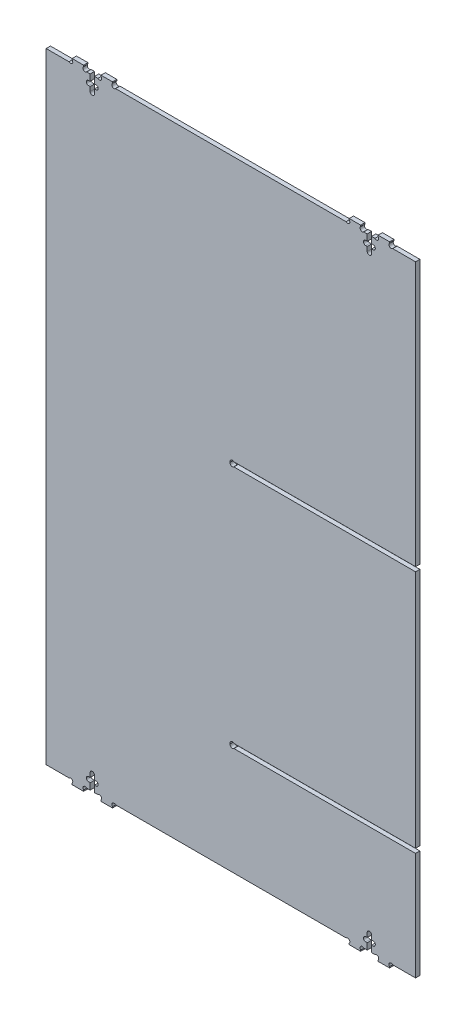
from build123d import *

# Parameters (mm, degrees)
SKETCH_1_W                      = 524
SKETCH_1_H                      = 865.6
EXTRUDE_1_DEPTH                 = 6
SKETCH_5541_W                   = 16
SKETCH_5541_H                   = 6.01
EXTRUDE_6_DEPTH                 = 6
CUT_EXTRUDE_5_DEPTH             = 753.700441094
CUT_EXTRUDE_5_DEPTH_BACK        = 753.700441094
SKETCH_5_W                      = 328
SKETCH_5_H                      = 6
CUT_EXTRUDE_6_01_DEPTH          = 750.906944813
CUT_EXTRUDE_6_01_DEPTH_BACK     = 750.906944813
SKETCH_6_01_W                   = 6
SKETCH_6_01_H                   = 21.2
CUT_EXTRUDE_6_01_2_DEPTH        = 750.906944813
CUT_EXTRUDE_6_01_2_DEPTH_BACK   = 750.906944813
SKETCH_6_01_2_W                 = 10.3
SKETCH_6_01_2_H                 = 6.2
CUT_EXTRUDE_6_01_1_DEPTH        = 750.906944813
CUT_EXTRUDE_6_01_1_DEPTH_BACK   = 750.906944813
SKETCH_6_01_1_R                 = 3.05
CUT_EXTRUDE_6_01_1_2_DEPTH      = 750.906944813
CUT_EXTRUDE_6_01_1_2_DEPTH_BACK = 750.906944813
SKETCH_6_01_1_2_R               = 3.05
CUT_EXTRUDE_6_01_3_DEPTH        = 750.906944813
CUT_EXTRUDE_6_01_3_DEPTH_BACK   = 750.906944813
SKETCH_6_01_3_R                 = 3
CUT_EXTRUDE_6_02_DEPTH          = 750.906944813
CUT_EXTRUDE_6_02_DEPTH_BACK     = 750.906944813
SKETCH_6_02_W                   = 6
SKETCH_6_02_H                   = 21.2
CUT_EXTRUDE_6_02_2_DEPTH        = 750.906944813
CUT_EXTRUDE_6_02_2_DEPTH_BACK   = 750.906944813
SKETCH_6_02_2_W                 = 10.3
SKETCH_6_02_2_H                 = 6.2
CUT_EXTRUDE_6_02_1_DEPTH        = 750.906944813
CUT_EXTRUDE_6_02_1_DEPTH_BACK   = 750.906944813
SKETCH_6_02_1_R                 = 3.05
CUT_EXTRUDE_6_02_1_2_DEPTH      = 750.906944813
CUT_EXTRUDE_6_02_1_2_DEPTH_BACK = 750.906944813
SKETCH_6_02_1_2_R               = 3.05
CUT_EXTRUDE_6_02_3_DEPTH        = 750.906944813
CUT_EXTRUDE_6_02_3_DEPTH_BACK   = 750.906944813
SKETCH_6_02_3_R                 = 3
CUT_EXTRUDE_6_03_DEPTH          = 750.906944813
CUT_EXTRUDE_6_03_DEPTH_BACK     = 750.906944813
SKETCH_6_03_W                   = 6
SKETCH_6_03_H                   = 21.2
CUT_EXTRUDE_6_03_2_DEPTH        = 750.906944813
CUT_EXTRUDE_6_03_2_DEPTH_BACK   = 750.906944813
SKETCH_6_03_2_W                 = 10.3
SKETCH_6_03_2_H                 = 6.2
CUT_EXTRUDE_6_03_1_DEPTH        = 750.906944813
CUT_EXTRUDE_6_03_1_DEPTH_BACK   = 750.906944813
SKETCH_6_03_1_R                 = 3.05
CUT_EXTRUDE_6_03_1_2_DEPTH      = 750.906944813
CUT_EXTRUDE_6_03_1_2_DEPTH_BACK = 750.906944813
SKETCH_6_03_1_2_R               = 3.05
CUT_EXTRUDE_6_03_3_DEPTH        = 750.906944813
CUT_EXTRUDE_6_03_3_DEPTH_BACK   = 750.906944813
SKETCH_6_03_3_R                 = 3
CUT_EXTRUDE_6_04_DEPTH          = 750.906944813
CUT_EXTRUDE_6_04_DEPTH_BACK     = 750.906944813
SKETCH_6_04_W                   = 6
SKETCH_6_04_H                   = 21.2
CUT_EXTRUDE_6_04_2_DEPTH        = 750.906944813
CUT_EXTRUDE_6_04_2_DEPTH_BACK   = 750.906944813
SKETCH_6_04_2_W                 = 10.3
SKETCH_6_04_2_H                 = 6.2
CUT_EXTRUDE_6_04_1_DEPTH        = 750.906944813
CUT_EXTRUDE_6_04_1_DEPTH_BACK   = 750.906944813
SKETCH_6_04_1_R                 = 3.05
CUT_EXTRUDE_6_04_1_2_DEPTH      = 750.906944813
CUT_EXTRUDE_6_04_1_2_DEPTH_BACK = 750.906944813
SKETCH_6_04_1_2_R               = 3.05
CUT_EXTRUDE_6_04_3_DEPTH        = 750.906944813
CUT_EXTRUDE_6_04_3_DEPTH_BACK   = 750.906944813
SKETCH_6_04_3_R                 = 3
CUT_EXTRUDE_01_DEPTH            = 750.906944813
CUT_EXTRUDE_01_DEPTH_BACK       = 750.906944813
SKETCH_01_R                     = 3.05
CUT_EXTRUDE_02_DEPTH            = 750.906944813
CUT_EXTRUDE_02_DEPTH_BACK       = 750.906944813
SKETCH_02_R                     = 3.05
CUT_EXTRUDE_03_DEPTH            = 750.906944813
CUT_EXTRUDE_03_DEPTH_BACK       = 750.906944813
SKETCH_03_R                     = 3.05
CUT_EXTRUDE_04_DEPTH            = 750.906944813
CUT_EXTRUDE_04_DEPTH_BACK       = 750.906944813
SKETCH_04_R                     = 3.05


with BuildPart() as part:
    # Эскиз1 → Бобышка-Вытянуть1 (new body)
    with BuildSketch(Plane.XY):
        with Locations((-90.794024, 232.074672892)):
            Rectangle(SKETCH_1_W, SKETCH_1_H)
    extrude(amount=-EXTRUDE_1_DEPTH)

    # Sketch 5541 → Стыки_добавленные_шипы_6мм (add)
    with BuildSketch(Plane.XY):
        with Locations((-262.794024, -203.720327)):
            Rectangle(SKETCH_5541_W, SKETCH_5541_H)
        with Locations((-302.794024, -203.720327)):
            Rectangle(SKETCH_5541_W, SKETCH_5541_H)
        with Locations((121.205976, -203.720327)):
            Rectangle(SKETCH_5541_W, SKETCH_5541_H)
        with Locations((81.205976, -203.720327)):
            Rectangle(SKETCH_5541_W, SKETCH_5541_H)
    extrude(amount=-EXTRUDE_6_DEPTH)

    # Стыки_эскиз_пазов_и_стяжек_М5 → Стыки_шип_паз_стяжки_М5 (cut, two sides: drawn at the far end of the back side and taken through both)
    with BuildSketch(Plane.XY.offset(-CUT_EXTRUDE_5_DEPTH_BACK)):
        Polygon((-280.044024, -190.875327), (-278.644024, -190.875327), (-278.644024, -186.575327), (-280.044024, -186.575327), (-280.044024, -179.725327), (-285.544024, -179.725327), (-285.544024, -186.575327), (-286.944024, -186.575327), (-286.944024, -190.875327), (-285.544024, -190.875327), (-285.544024, -206.825327), (-280.044024, -206.825327), align=None)
        Polygon((-352.894024, 664.874673), (-352.894024, 658.874673), (-352.794024, 658.874673), (-352.794024, -200.725327), (-346.794024, -200.725327), (-346.794024, 658.874673), (-310.794024, 658.874673), (-310.794024, 664.874673), align=None)
        Polygon((-90.869024, -51.200327), (165.205976, -51.200327), (165.205976, -200.725327), (171.205976, -200.725327), (171.205976, -51.200327), (171.305976, -51.200327), (171.305976, -45.050327), (171.205976, -45.050327), (171.205976, 286.799673), (171.305976, 286.799673), (171.305976, 292.949673), (171.205976, 292.949673), (171.205976, 658.874673), (171.305976, 658.874673), (171.305976, 664.874673), (129.205976, 664.874673), (129.205976, 658.874673), (165.205976, 658.874673), (165.205976, 292.949673), (-90.869024, 292.949673), (-90.869024, 286.799673), (165.205976, 286.799673), (165.205976, -45.050327), (-90.869024, -45.050327), align=None)
        Polygon((98.455976, 658.874673), (98.455976, 649.024673), (97.055976, 649.024673), (97.055976, 644.724673), (98.455976, 644.724673), (98.455976, 637.874673), (103.955976, 637.874673), (103.955976, 644.724673), (105.355976, 644.724673), (105.355976, 649.024673), (103.955976, 649.024673), (103.955976, 658.874673), (113.205976, 658.874673), (113.205976, 664.874673), (103.955976, 664.874673), (103.955976, 664.974673), (98.455976, 664.974673), (98.455976, 664.874673), (89.205976, 664.874673), (89.205976, 658.874673), align=None)
        Polygon((-285.544024, 658.874673), (-285.544024, 649.024673), (-286.944024, 649.024673), (-286.944024, 644.724673), (-285.544024, 644.724673), (-285.544024, 637.874673), (-280.044024, 637.874673), (-280.044024, 644.724673), (-278.644024, 644.724673), (-278.644024, 649.024673), (-280.044024, 649.024673), (-280.044024, 658.874673), (-270.794024, 658.874673), (-270.794024, 664.874673), (-280.044024, 664.874673), (-280.044024, 664.974673), (-285.544024, 664.974673), (-285.544024, 664.874673), (-294.794024, 664.874673), (-294.794024, 658.874673), align=None)
        Polygon((103.955976, -206.825327), (103.955976, -190.875327), (105.355976, -190.875327), (105.355976, -186.575327), (103.955976, -186.575327), (103.955976, -179.725327), (98.455976, -179.725327), (98.455976, -186.575327), (97.055976, -186.575327), (97.055976, -190.875327), (98.455976, -190.875327), (98.455976, -206.825327), align=None)
        with Locations((-90.794024, 661.874673)):
            Rectangle(SKETCH_5_W, SKETCH_5_H)
    extrude(amount=CUT_EXTRUDE_5_DEPTH + CUT_EXTRUDE_5_DEPTH_BACK, mode=Mode.SUBTRACT)

    # Sketch 6_01 → Cut-Extrude 6_01 (cut, two sides: drawn at the far end of the back side and taken through both)
    with BuildSketch(Plane.XY.offset(-CUT_EXTRUDE_6_01_DEPTH_BACK)):
        with Locations((-282.79402, 648.37467)):
            Rectangle(SKETCH_6_01_W, SKETCH_6_01_H)
    extrude(amount=CUT_EXTRUDE_6_01_DEPTH + CUT_EXTRUDE_6_01_DEPTH_BACK, mode=Mode.SUBTRACT)

    # Sketch 6_01 2 → Cut-Extrude 6_01 2 (cut, two sides: drawn at the far end of the back side and taken through both)
    with BuildSketch(Plane.XY.offset(-CUT_EXTRUDE_6_01_2_DEPTH_BACK)):
        with Locations((-282.79402, 646.87467)):
            Rectangle(SKETCH_6_01_2_W, SKETCH_6_01_2_H)
    extrude(amount=CUT_EXTRUDE_6_01_2_DEPTH + CUT_EXTRUDE_6_01_2_DEPTH_BACK, mode=Mode.SUBTRACT)

    # Sketch 6_01_____1 → Cut-Extrude 6_01_____1 (cut, two sides: drawn at the far end of the back side and taken through both)
    with BuildSketch(Plane.XY.offset(-CUT_EXTRUDE_6_01_1_DEPTH_BACK)):
        with Locations((-277.64402, 646.92467)):
            Circle(SKETCH_6_01_1_R)
        with Locations((-287.94402, 646.92467)):
            Circle(SKETCH_6_01_1_R)
    extrude(amount=CUT_EXTRUDE_6_01_1_DEPTH + CUT_EXTRUDE_6_01_1_DEPTH_BACK, mode=Mode.SUBTRACT)

    # Sketch 6_01_____-1 2 → Cut-Extrude 6_01_____-1 2 (cut, two sides: drawn at the far end of the back side and taken through both)
    with BuildSketch(Plane.XY.offset(-CUT_EXTRUDE_6_01_1_2_DEPTH_BACK)):
        with Locations((-277.64402, 646.82467)):
            Circle(SKETCH_6_01_1_2_R)
        with Locations((-287.94402, 646.82467)):
            Circle(SKETCH_6_01_1_2_R)
    extrude(amount=CUT_EXTRUDE_6_01_1_2_DEPTH + CUT_EXTRUDE_6_01_1_2_DEPTH_BACK, mode=Mode.SUBTRACT)

    # Sketch 6_01 3 → Cut-Extrude 6_01 3 (cut, two sides: drawn at the far end of the back side and taken through both)
    with BuildSketch(Plane.XY.offset(-CUT_EXTRUDE_6_01_3_DEPTH_BACK)):
        with Locations((-282.79402, 637.77467)):
            Circle(SKETCH_6_01_3_R)
    extrude(amount=CUT_EXTRUDE_6_01_3_DEPTH + CUT_EXTRUDE_6_01_3_DEPTH_BACK, mode=Mode.SUBTRACT)

    # Sketch 6_02 → Cut-Extrude 6_02 (cut, two sides: drawn at the far end of the back side and taken through both)
    with BuildSketch(Plane.XY.offset(-CUT_EXTRUDE_6_02_DEPTH_BACK)):
        with Locations((101.20598, 648.37467)):
            Rectangle(SKETCH_6_02_W, SKETCH_6_02_H)
    extrude(amount=CUT_EXTRUDE_6_02_DEPTH + CUT_EXTRUDE_6_02_DEPTH_BACK, mode=Mode.SUBTRACT)

    # Sketch 6_02 2 → Cut-Extrude 6_02 2 (cut, two sides: drawn at the far end of the back side and taken through both)
    with BuildSketch(Plane.XY.offset(-CUT_EXTRUDE_6_02_2_DEPTH_BACK)):
        with Locations((101.20598, 646.87467)):
            Rectangle(SKETCH_6_02_2_W, SKETCH_6_02_2_H)
    extrude(amount=CUT_EXTRUDE_6_02_2_DEPTH + CUT_EXTRUDE_6_02_2_DEPTH_BACK, mode=Mode.SUBTRACT)

    # Sketch 6_02_____1 → Cut-Extrude 6_02_____1 (cut, two sides: drawn at the far end of the back side and taken through both)
    with BuildSketch(Plane.XY.offset(-CUT_EXTRUDE_6_02_1_DEPTH_BACK)):
        with Locations((106.35598, 646.92467)):
            Circle(SKETCH_6_02_1_R)
        with Locations((96.05598, 646.92467)):
            Circle(SKETCH_6_02_1_R)
    extrude(amount=CUT_EXTRUDE_6_02_1_DEPTH + CUT_EXTRUDE_6_02_1_DEPTH_BACK, mode=Mode.SUBTRACT)

    # Sketch 6_02_____-1 2 → Cut-Extrude 6_02_____-1 2 (cut, two sides: drawn at the far end of the back side and taken through both)
    with BuildSketch(Plane.XY.offset(-CUT_EXTRUDE_6_02_1_2_DEPTH_BACK)):
        with Locations((106.35598, 646.82467)):
            Circle(SKETCH_6_02_1_2_R)
        with Locations((96.05598, 646.82467)):
            Circle(SKETCH_6_02_1_2_R)
    extrude(amount=CUT_EXTRUDE_6_02_1_2_DEPTH + CUT_EXTRUDE_6_02_1_2_DEPTH_BACK, mode=Mode.SUBTRACT)

    # Sketch 6_02 3 → Cut-Extrude 6_02 3 (cut, two sides: drawn at the far end of the back side and taken through both)
    with BuildSketch(Plane.XY.offset(-CUT_EXTRUDE_6_02_3_DEPTH_BACK)):
        with Locations((101.20598, 637.77467)):
            Circle(SKETCH_6_02_3_R)
    extrude(amount=CUT_EXTRUDE_6_02_3_DEPTH + CUT_EXTRUDE_6_02_3_DEPTH_BACK, mode=Mode.SUBTRACT)

    # Sketch 6_03 → Cut-Extrude 6_03 (cut, two sides: drawn at the far end of the back side and taken through both)
    with BuildSketch(Plane.XY.offset(-CUT_EXTRUDE_6_03_DEPTH_BACK)):
        with Locations((101.20598, -190.22533)):
            Rectangle(SKETCH_6_03_W, SKETCH_6_03_H)
    extrude(amount=CUT_EXTRUDE_6_03_DEPTH + CUT_EXTRUDE_6_03_DEPTH_BACK, mode=Mode.SUBTRACT)

    # Sketch 6_03 2 → Cut-Extrude 6_03 2 (cut, two sides: drawn at the far end of the back side and taken through both)
    with BuildSketch(Plane.XY.offset(-CUT_EXTRUDE_6_03_2_DEPTH_BACK)):
        with Locations((101.20598, -188.72533)):
            Rectangle(SKETCH_6_03_2_W, SKETCH_6_03_2_H)
    extrude(amount=CUT_EXTRUDE_6_03_2_DEPTH + CUT_EXTRUDE_6_03_2_DEPTH_BACK, mode=Mode.SUBTRACT)

    # Sketch 6_03_____1 → Cut-Extrude 6_03_____1 (cut, two sides: drawn at the far end of the back side and taken through both)
    with BuildSketch(Plane.XY.offset(-CUT_EXTRUDE_6_03_1_DEPTH_BACK)):
        with Locations((106.35598, -188.67533)):
            Circle(SKETCH_6_03_1_R)
        with Locations((96.05598, -188.67533)):
            Circle(SKETCH_6_03_1_R)
    extrude(amount=CUT_EXTRUDE_6_03_1_DEPTH + CUT_EXTRUDE_6_03_1_DEPTH_BACK, mode=Mode.SUBTRACT)

    # Sketch 6_03_____-1 2 → Cut-Extrude 6_03_____-1 2 (cut, two sides: drawn at the far end of the back side and taken through both)
    with BuildSketch(Plane.XY.offset(-CUT_EXTRUDE_6_03_1_2_DEPTH_BACK)):
        with Locations((106.35598, -188.77533)):
            Circle(SKETCH_6_03_1_2_R)
        with Locations((96.05598, -188.77533)):
            Circle(SKETCH_6_03_1_2_R)
    extrude(amount=CUT_EXTRUDE_6_03_1_2_DEPTH + CUT_EXTRUDE_6_03_1_2_DEPTH_BACK, mode=Mode.SUBTRACT)

    # Sketch 6_03 3 → Cut-Extrude 6_03 3 (cut, two sides: drawn at the far end of the back side and taken through both)
    with BuildSketch(Plane.XY.offset(-CUT_EXTRUDE_6_03_3_DEPTH_BACK)):
        with Locations((101.20598, -179.62533)):
            Circle(SKETCH_6_03_3_R)
    extrude(amount=CUT_EXTRUDE_6_03_3_DEPTH + CUT_EXTRUDE_6_03_3_DEPTH_BACK, mode=Mode.SUBTRACT)

    # Sketch 6_04 → Cut-Extrude 6_04 (cut, two sides: drawn at the far end of the back side and taken through both)
    with BuildSketch(Plane.XY.offset(-CUT_EXTRUDE_6_04_DEPTH_BACK)):
        with Locations((-282.79402, -190.22533)):
            Rectangle(SKETCH_6_04_W, SKETCH_6_04_H)
    extrude(amount=CUT_EXTRUDE_6_04_DEPTH + CUT_EXTRUDE_6_04_DEPTH_BACK, mode=Mode.SUBTRACT)

    # Sketch 6_04 2 → Cut-Extrude 6_04 2 (cut, two sides: drawn at the far end of the back side and taken through both)
    with BuildSketch(Plane.XY.offset(-CUT_EXTRUDE_6_04_2_DEPTH_BACK)):
        with Locations((-282.79402, -188.72533)):
            Rectangle(SKETCH_6_04_2_W, SKETCH_6_04_2_H)
    extrude(amount=CUT_EXTRUDE_6_04_2_DEPTH + CUT_EXTRUDE_6_04_2_DEPTH_BACK, mode=Mode.SUBTRACT)

    # Sketch 6_04_____1 → Cut-Extrude 6_04_____1 (cut, two sides: drawn at the far end of the back side and taken through both)
    with BuildSketch(Plane.XY.offset(-CUT_EXTRUDE_6_04_1_DEPTH_BACK)):
        with Locations((-277.64402, -188.67533)):
            Circle(SKETCH_6_04_1_R)
        with Locations((-287.94402, -188.67533)):
            Circle(SKETCH_6_04_1_R)
    extrude(amount=CUT_EXTRUDE_6_04_1_DEPTH + CUT_EXTRUDE_6_04_1_DEPTH_BACK, mode=Mode.SUBTRACT)

    # Sketch 6_04_____-1 2 → Cut-Extrude 6_04_____-1 2 (cut, two sides: drawn at the far end of the back side and taken through both)
    with BuildSketch(Plane.XY.offset(-CUT_EXTRUDE_6_04_1_2_DEPTH_BACK)):
        with Locations((-277.64402, -188.77533)):
            Circle(SKETCH_6_04_1_2_R)
        with Locations((-287.94402, -188.77533)):
            Circle(SKETCH_6_04_1_2_R)
    extrude(amount=CUT_EXTRUDE_6_04_1_2_DEPTH + CUT_EXTRUDE_6_04_1_2_DEPTH_BACK, mode=Mode.SUBTRACT)

    # Sketch 6_04 3 → Cut-Extrude 6_04 3 (cut, two sides: drawn at the far end of the back side and taken through both)
    with BuildSketch(Plane.XY.offset(-CUT_EXTRUDE_6_04_3_DEPTH_BACK)):
        with Locations((-282.79402, -179.62533)):
            Circle(SKETCH_6_04_3_R)
    extrude(amount=CUT_EXTRUDE_6_04_3_DEPTH + CUT_EXTRUDE_6_04_3_DEPTH_BACK, mode=Mode.SUBTRACT)

    # ЧПУ_Шаблон_углов_01 → ЧПУ_Разгрузки_01 (cut, two sides: drawn at the far end of the back side and taken through both)
    with BuildSketch(Plane.XY.offset(-CUT_EXTRUDE_01_DEPTH_BACK)):
        with Locations((-272.915344344, 660.995993344)):
            Circle(SKETCH_01_R)
        with Locations((71.084655656, 660.995993344)):
            Circle(SKETCH_01_R)
        with Locations((111.084655656, 660.995993344)):
            Circle(SKETCH_01_R)
        with Locations((-312.915344344, 660.995993344)):
            Circle(SKETCH_01_R)
    extrude(amount=CUT_EXTRUDE_01_DEPTH + CUT_EXTRUDE_01_DEPTH_BACK, mode=Mode.SUBTRACT)

    # ЧПУ_Шаблон_углов_02 → ЧПУ_Разгрузки_02 (cut, two sides: drawn at the far end of the back side and taken through both)
    with BuildSketch(Plane.XY.offset(-CUT_EXTRUDE_02_DEPTH_BACK)):
        with Locations((-252.672703656, 660.995993344)):
            Circle(SKETCH_02_R)
        with Locations((91.327296344, 660.995993344)):
            Circle(SKETCH_02_R)
        with Locations((131.327296344, 660.995993344)):
            Circle(SKETCH_02_R)
        with Locations((-88.747703656, 288.920993344)):
            Circle(SKETCH_02_R)
        with Locations((-88.747703656, -49.079006656)):
            Circle(SKETCH_02_R)
        with Locations((-292.672703656, 660.995993344)):
            Circle(SKETCH_02_R)
    extrude(amount=CUT_EXTRUDE_02_DEPTH + CUT_EXTRUDE_02_DEPTH_BACK, mode=Mode.SUBTRACT)

    # ЧПУ_Шаблон_углов_03 → ЧПУ_Разгрузки_03 (cut, two sides: drawn at the far end of the back side and taken through both)
    with BuildSketch(Plane.XY.offset(-CUT_EXTRUDE_03_DEPTH_BACK)):
        with Locations((-88.747703656, 290.828352656)):
            Circle(SKETCH_03_R)
        with Locations((-88.747703656, -47.171647344)):
            Circle(SKETCH_03_R)
        with Locations((131.327296344, -202.846647452)):
            Circle(SKETCH_03_R)
        with Locations((91.327296344, -202.846647452)):
            Circle(SKETCH_03_R)
        with Locations((-252.672703656, -202.846647452)):
            Circle(SKETCH_03_R)
        with Locations((-292.672703656, -202.846647452)):
            Circle(SKETCH_03_R)
    extrude(amount=CUT_EXTRUDE_03_DEPTH + CUT_EXTRUDE_03_DEPTH_BACK, mode=Mode.SUBTRACT)

    # ЧПУ_Шаблон_углов_04 → ЧПУ_Разгрузки_04 (cut, two sides: drawn at the far end of the back side and taken through both)
    with BuildSketch(Plane.XY.offset(-CUT_EXTRUDE_04_DEPTH_BACK)):
        with Locations((111.084655656, -202.846647452)):
            Circle(SKETCH_04_R)
        with Locations((71.084655656, -202.846647452)):
            Circle(SKETCH_04_R)
        with Locations((-272.915344344, -202.846647452)):
            Circle(SKETCH_04_R)
        with Locations((-312.915344344, -202.846647452)):
            Circle(SKETCH_04_R)
    extrude(amount=CUT_EXTRUDE_04_DEPTH + CUT_EXTRUDE_04_DEPTH_BACK, mode=Mode.SUBTRACT)


solid = part.part
